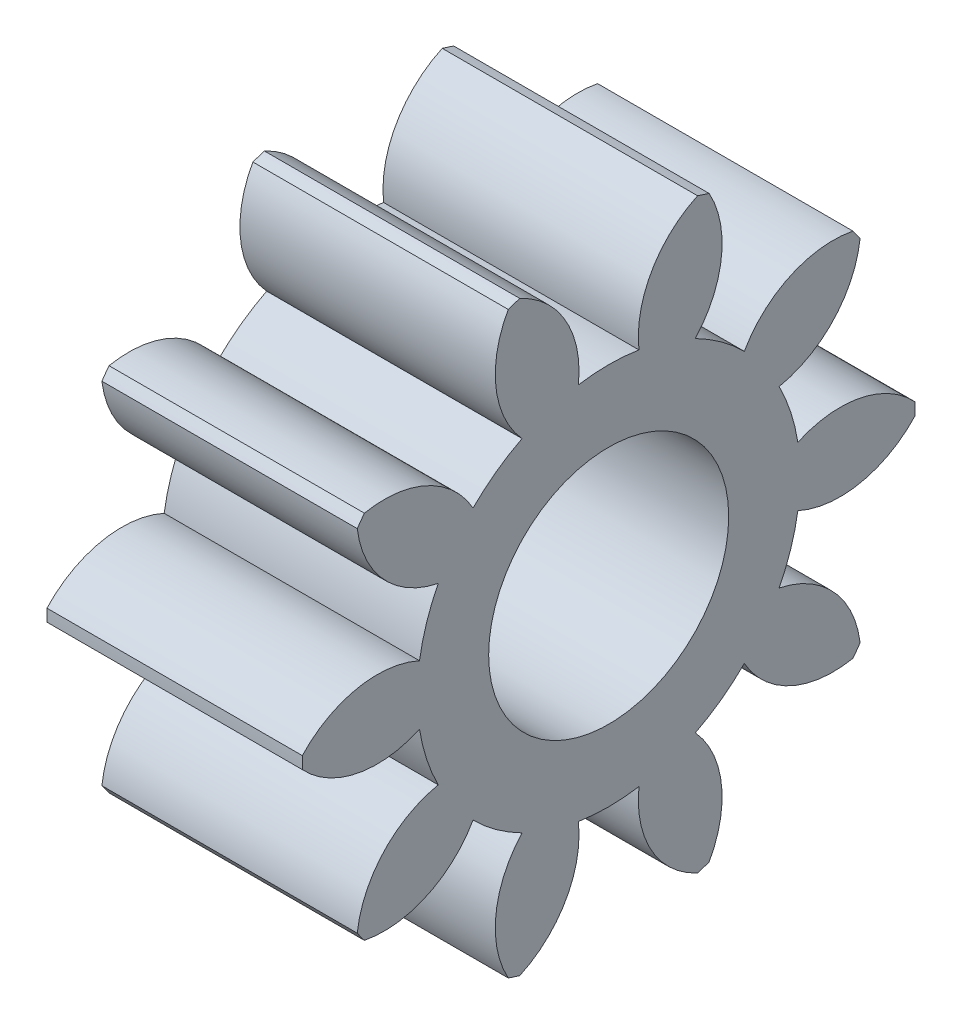
from build123d import *

# Parameters (mm, degrees)
BASPROSKE_W        = 5
BASPROSKE_H        = 6
TOOTHCUT_DEPTH     = 10.848857802
TEETHCUTS_COUNT    = 10
TEETHCUTS_ANGLE    = 324
BORSKE_R           = 0.4
BORE_DEPTH         = 50.0000508
SKETCH1_R          = 2.35
CUT_EXTRUDE1_DEPTH = 10.693816982


with BuildPart() as part:
    # BasProSke → Base-Revolve (revolve)
    with BuildSketch(Plane(origin=(0, 0, 0), x_dir=(1, 0, 0), z_dir=(0, 1, 0))):
        with Locations((2.5, 3)):
            Rectangle(BASPROSKE_W, BASPROSKE_H)
    revolve(axis=Axis((-10, 0, 0), (1, 0, 0)))

    # TooCutSke → ToothCut (cut, through all)
    with BuildSketch(Plane(origin=(0, 0, 0), x_dir=(0, 0, -1), z_dir=(1, 0, 0))):
        with BuildLine():
            ThreePointArc((0.59278292, 3.701838653), (0, 3.749), (-0.59278292, 3.701838653))
            ThreePointArc((-0.59278292, 3.701838653), (-0.846593509, 4.924114224), (-1.775771316, 5.757784417))
            ThreePointArc((-1.775771316, 5.757784417), (0, 6.0254), (1.775771316, 5.757784417))
            ThreePointArc((1.775771316, 5.757784417), (0.846593509, 4.924114224), (0.59278292, 3.701838653))
        make_face()
    toothcut = extrude(amount=TOOTHCUT_DEPTH, mode=Mode.SUBTRACT)

    # TeethCuts: ToothCut ×10 about axis
    teethcuts_axis = Axis((-10, 0, 0), (1, 0, 0))
    for i in range(1, TEETHCUTS_COUNT):
        add(toothcut.rotate(teethcuts_axis, i * TEETHCUTS_ANGLE / (TEETHCUTS_COUNT - 1)), mode=Mode.SUBTRACT)

    # BorSke → Bore (cut, symmetric)
    with BuildSketch(Plane(origin=(0, 0, 0), x_dir=(0, 0, -1), z_dir=(1, 0, 0))):
        Circle(BORSKE_R)
    extrude(amount=BORE_DEPTH, both=True, mode=Mode.SUBTRACT)

    # Sketch1 → Cut-Extrude1 (cut, through all)
    with BuildSketch(Plane(origin=(5, 0, 0), x_dir=(0, 0, -1), z_dir=(1, 0, 0))):
        Circle(SKETCH1_R)
    extrude(amount=-CUT_EXTRUDE1_DEPTH, mode=Mode.SUBTRACT)


solid = part.part
